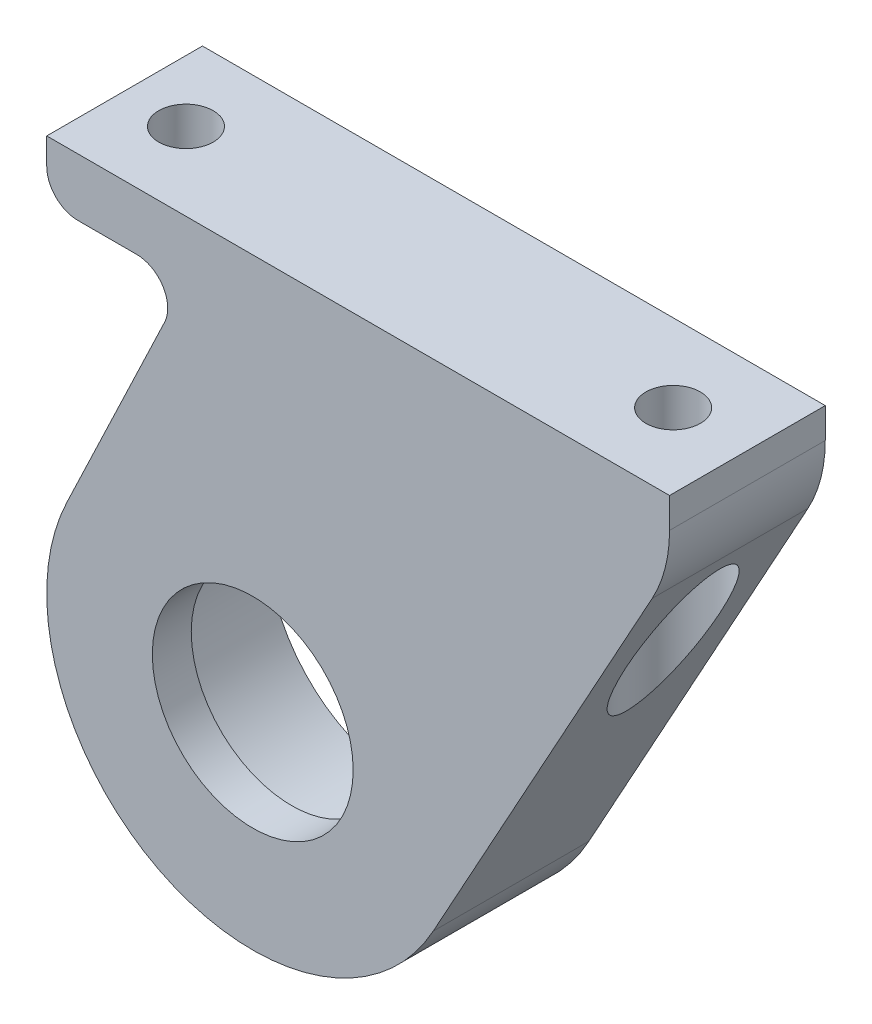
from build123d import *

# Parameters (mm, degrees)
SKETCH1_R           = 9.05
BOSS_EXTRUDE1_DEPTH = 10
SKETCH2_R           = 10.943185219
SKETCH2_R_2         = 6.45
BOSS_EXTRUDE2_DEPTH = 2.5
CUT_EXTRUDE3_START  = -0.7
SKETCH5_R           = 3
CUT_EXTRUDE3_DEPTH  = 11.7
SKETCH3_R           = 1.75
CUT_EXTRUDE4_DEPTH  = 14
CUT_EXTRUDE5_START  = -3
SKETCH7_R           = 3
CUT_EXTRUDE5_DEPTH  = 43.806361079


with BuildPart() as part:
    # Sketch1 → Boss-Extrude1 (new body)
    with BuildSketch(Plane.XY):
        with BuildLine():
            Line((-22.423245911, 18.324552881), (-22.423245911, 20.027910696))
            Line((-22.423245911, 20.027910696), (17.576754089, 20.027910696))
            Line((17.576754089, 20.027910696), (17.576754089, 18.085752847))
            ThreePointArc((17.576754089, 18.085752847), (17.293213531, 15.844473124), (16.460457468, 13.744414224))
            Line((16.460457468, 13.744414224), (2.397055762, -11.794180476))
            ThreePointArc((2.397055762, -11.794180476), (-15.234635861, -17.182567052), (-21.133926205, 0.284820641))
            Line((-21.133926205, 0.284820641), (-14.846773288, 13.463385644))
            ThreePointArc((-14.846773288, 13.463385644), (-14.96037615, 15.391713957), (-16.651874668, 16.324552881))
            Line((-16.651874668, 16.324552881), (-20.423245911, 16.324552881))
            ThreePointArc((-20.423245911, 16.324552881), (-21.837459474, 16.910339318), (-22.423245911, 18.324552881))
        make_face()
        with Locations((-9.19257548, -5.412089304)):
            Circle(SKETCH1_R, mode=Mode.SUBTRACT)
    extrude(amount=BOSS_EXTRUDE1_DEPTH)

    # Sketch2 → Boss-Extrude2 (add)
    with BuildSketch(Plane.XY.offset(10)):
        with Locations((-9.19257548, -5.412089304)):
            Circle(SKETCH2_R)
        with Locations((-9.19257548, -5.412089304)):
            Circle(SKETCH2_R_2, mode=Mode.SUBTRACT)
    extrude(amount=-BOSS_EXTRUDE2_DEPTH)

    # Sketch5 → Cut-Extrude3 (cut)
    with BuildSketch(Plane.XZ.offset(-16.324552881).offset(CUT_EXTRUDE3_START)):
        with Locations((-18.481973971, 5)):
            Circle(SKETCH5_R)
    extrude(amount=CUT_EXTRUDE3_DEPTH, mode=Mode.SUBTRACT)

    # Sketch3 → Cut-Extrude4 (cut)
    with BuildSketch(Plane(origin=(0, 20.027910696, 0), x_dir=(1, 0, 0), z_dir=(0, 1, 0))):
        with Locations((-18.481973971, -5)):
            Circle(SKETCH3_R)
        with Locations((12.806754089, -5)):
            Circle(SKETCH3_R)
    extrude(amount=-CUT_EXTRUDE4_DEPTH, mode=Mode.SUBTRACT)

    # Sketch7 → Cut-Extrude5 (cut, through all)
    with BuildSketch(Plane(origin=(0, 20.027910696, 0), x_dir=(1, 0, 0), z_dir=(0, 1, 0)).offset(CUT_EXTRUDE5_START)):
        with Locations((12.806754089, -5)):
            Circle(SKETCH7_R)
    extrude(amount=-CUT_EXTRUDE5_DEPTH, mode=Mode.SUBTRACT)


solid = part.part
